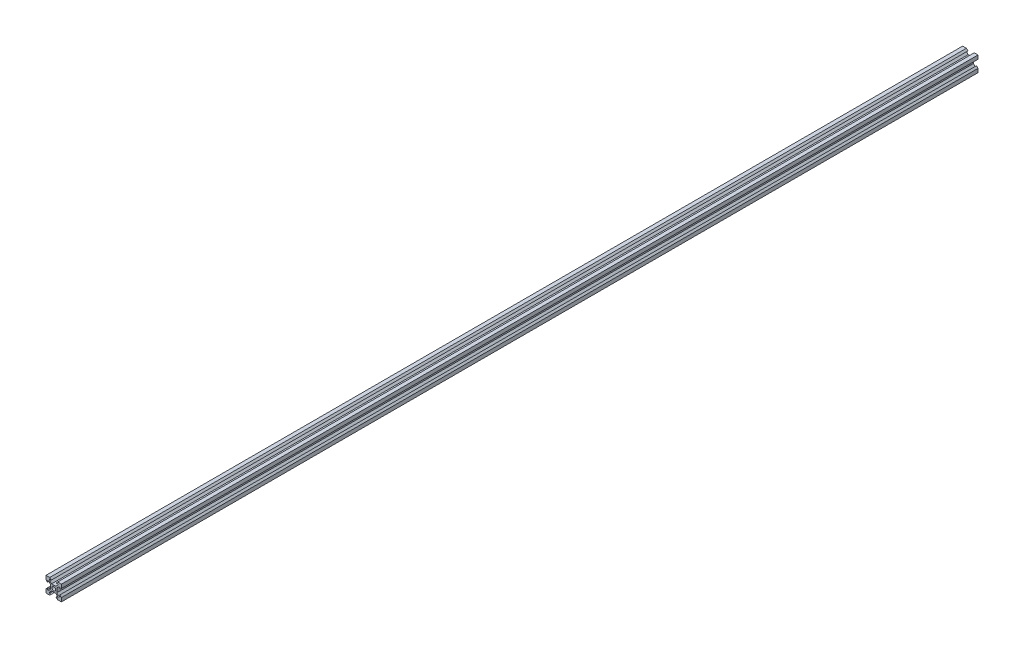
from build123d import *

# Parameters (mm, degrees)
SKETCH1_R              = 2.5
BOSS_EXTRUDE1_DEPTH    = 1200
CUT_REVOLVE1_START     = 1192
CUT_REVOLVE1_OUTLINE_R = 2.5
CUT_REVOLVE1_DEPTH     = 8


# Read off the part's stored shape, not the designer's step: Cut-Revolve1
with BuildPart() as part:
    # Sketch1 → Boss-Extrude1 (new body)
    with BuildSketch(Plane.XY):
        Polygon((-2.727207794, 4), (2.727207794, 4), (5.3, 6.572792206), (5.3, 8), (3.1, 8), (5.1, 10), (10, 10), (10, 5.1), (8, 3.1), (8, 5.3), (6.572792206, 5.3), (4, 2.727207794), (4, -2.727207794), (6.572792206, -5.3), (8, -5.3), (8, -3.1), (10, -5.1), (10, -10), (5.1, -10), (3.1, -8), (5.3, -8), (5.3, -6.572792206), (2.727207794, -4), (-2.727207794, -4), (-5.3, -6.572792206), (-5.3, -8), (-3.1, -8), (-5.1, -10), (-10, -10), (-10, -5.1), (-8, -3.1), (-8, -5.3), (-6.572792206, -5.3), (-4, -2.727207794), (-4, 2.727207794), (-6.572792206, 5.3), (-8, 5.3), (-8, 3.1), (-10, 5.1), (-10, 10), (-5.1, 10), (-3.1, 8), (-5.3, 8), (-5.3, 6.572792206), align=None)
        Circle(SKETCH1_R, mode=Mode.SUBTRACT)
    extrude(amount=BOSS_EXTRUDE1_DEPTH)

    # Cut-Revolve1 outline → Cut-Revolve1 (cut)
    with BuildSketch(Plane.XY.offset(CUT_REVOLVE1_START)):
        Polygon((4, 2.727207794), (6.572792206, 5.3), (8, 5.3), (8, 3.1), (10, 5.1), (10, 10), (5.1, 10), (3.1, 8), (5.3, 8), (5.3, 6.572792206), (2.727207794, 4), (-2.727207794, 4), (-5.3, 6.572792206), (-5.3, 8), (-3.1, 8), (-5.1, 10), (-10, 10), (-10, 5.1), (-8, 3.1), (-8, 5.3), (-6.572792206, 5.3), (-4, 2.727207794), (-4, -2.727207794), (-6.572792206, -5.3), (-8, -5.3), (-8, -3.1), (-10, -5.1), (-10, -10), (-5.1, -10), (-3.1, -8), (-5.3, -8), (-5.3, -6.572792206), (-2.727207794, -4), (2.727207794, -4), (5.3, -6.572792206), (5.3, -8), (3.1, -8), (5.1, -10), (10, -10), (10, -5.1), (8, -3.1), (8, -5.3), (6.572792206, -5.3), (4, -2.727207794), align=None)
        Circle(CUT_REVOLVE1_OUTLINE_R, mode=Mode.SUBTRACT)
    extrude(amount=CUT_REVOLVE1_DEPTH, mode=Mode.SUBTRACT)


solid = part.part
